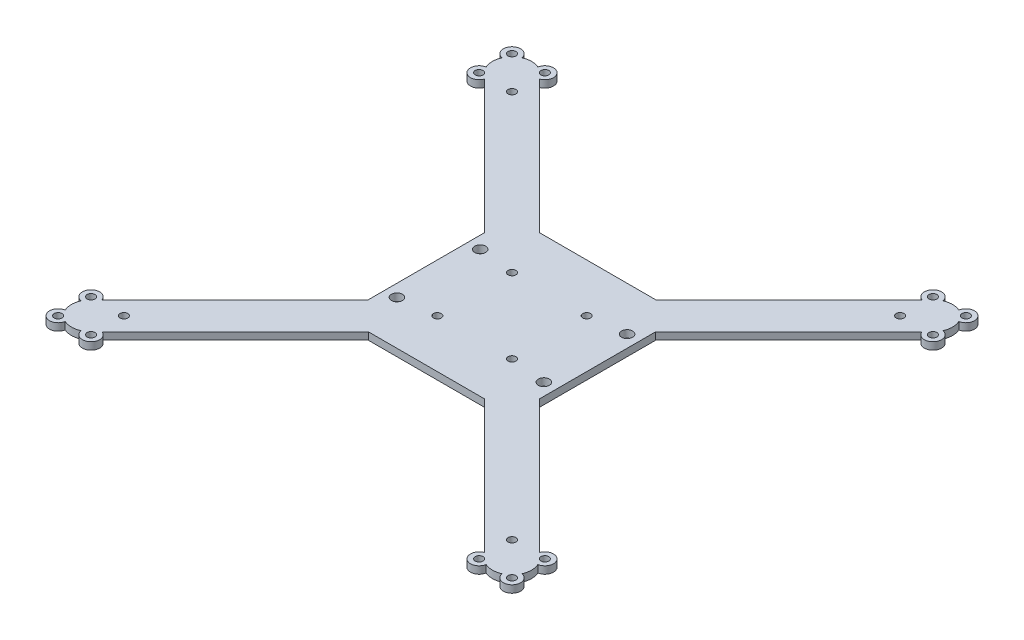
from build123d import *

# Parameters (mm, degrees)
SKETCH1_R           = 1.6
SKETCH1_R_2         = 2.25
BOSS_EXTRUDE1_DEPTH = 3
SKETCH4_R           = 6.495043718
SKETCH4_R_2         = 4.9
BOSS_EXTRUDE3_DEPTH = 5
SKETCH6_W           = 8.48311055
SKETCH6_H           = 1.891574962
CUT_EXTRUDE3_DEPTH  = 34


with BuildPart() as part:
    # Sketch1 → Boss-Extrude1 (new body)
    with BuildSketch(Plane(origin=(0, 0, 0), x_dir=(1, 0, 0), z_dir=(0, 1, 0))):
        with BuildLine():
            Line((-78.067755892, -89.381464391), (-23.686291501, -35))
            Line((-23.686291501, -35), (23.686291501, -35))
            Line((23.686291501, -35), (78.067755892, -89.381464391))
            ThreePointArc((78.067755892, -89.381464391), (76.99339786, -95.359340368), (82.693910545, -93.263296116))
            ThreePointArc((82.693910545, -93.263296116), (85.960678119, -93.960678119), (89.227445693, -93.263296116))
            ThreePointArc((89.227445693, -93.263296116), (95.153066274, -95.153066274), (93.263296116, -89.227445693))
            ThreePointArc((93.263296116, -89.227445693), (93.960678119, -85.960678119), (93.263296116, -82.693910545))
            ThreePointArc((93.263296116, -82.693910545), (95.359340368, -76.99339786), (89.381464391, -78.067755892))
            Line((89.381464391, -78.067755892), (35, -23.686291501))
            Line((35, -23.686291501), (35, 23.686291501))
            Line((35, 23.686291501), (89.381464391, 78.067755892))
            ThreePointArc((89.381464391, 78.067755892), (95.153066274, 76.768289963), (93.853600346, 82.539891847))
            ThreePointArc((93.853600346, 82.539891847), (93.561810399, 82.629787308), (93.263296116, 82.693910545))
            ThreePointArc((93.263296116, 82.693910545), (93.960678119, 85.960678119), (93.263296116, 89.227445693))
            ThreePointArc((93.263296116, 89.227445693), (95.153066274, 95.153066274), (89.227445693, 93.263296116))
            ThreePointArc((89.227445693, 93.263296116), (85.960678119, 93.960678119), (82.693910545, 93.263296116))
            ThreePointArc((82.693910545, 93.263296116), (82.629787308, 93.561810399), (82.539891847, 93.853600346))
            ThreePointArc((82.539891847, 93.853600346), (76.768289963, 95.153066274), (78.067755892, 89.381464391))
            Line((78.067755892, 89.381464391), (23.686291501, 35))
            Line((23.686291501, 35), (-23.686291501, 35))
            Line((-23.686291501, 35), (-78.067755892, 89.381464391))
            ThreePointArc((-78.067755892, 89.381464391), (-76.99339786, 95.359340368), (-82.693910545, 93.263296116))
            ThreePointArc((-82.693910545, 93.263296116), (-85.960678119, 93.960678119), (-89.227445693, 93.263296116))
            ThreePointArc((-89.227445693, 93.263296116), (-95.153066274, 95.153066274), (-93.263296116, 89.227445693))
            ThreePointArc((-93.263296116, 89.227445693), (-93.960678119, 85.960678119), (-93.263296116, 82.693910545))
            ThreePointArc((-93.263296116, 82.693910545), (-95.359340368, 76.99339786), (-89.381464391, 78.067755892))
            Line((-89.381464391, 78.067755892), (-35, 23.686291501))
            Line((-35, 23.686291501), (-35, -23.686291501))
            Line((-35, -23.686291501), (-89.381464391, -78.067755892))
            ThreePointArc((-89.381464391, -78.067755892), (-95.359340368, -76.99339786), (-93.263296116, -82.693910545))
            ThreePointArc((-93.263296116, -82.693910545), (-93.960678119, -85.960678119), (-93.263296116, -89.227445693))
            ThreePointArc((-93.263296116, -89.227445693), (-95.153066274, -95.153066274), (-89.227445693, -93.263296116))
            ThreePointArc((-89.227445693, -93.263296116), (-85.960678119, -93.960678119), (-82.693910545, -93.263296116))
            ThreePointArc((-82.693910545, -93.263296116), (-76.99339786, -95.359340368), (-78.067755892, -89.381464391))
        make_face()
        with Locations((-92.67819254, -92.67819254)):
            Circle(SKETCH1_R, mode=Mode.SUBTRACT)
        with Locations((-79.243163697, -92.67819254)):
            Circle(SKETCH1_R, mode=Mode.SUBTRACT)
        with Locations((-92.67819254, -79.243163697)):
            Circle(SKETCH1_R, mode=Mode.SUBTRACT)
        with Locations((-79.243163697, -79.243163697)):
            Circle(SKETCH1_R, mode=Mode.SUBTRACT)
        with Locations((-30, -17)):
            Circle(SKETCH1_R_2, mode=Mode.SUBTRACT)
        with Locations((-15.25, -15.25)):
            Circle(SKETCH1_R, mode=Mode.SUBTRACT)
        with Locations((79.243163697, -92.67819254)):
            Circle(SKETCH1_R, mode=Mode.SUBTRACT)
        with Locations((92.67819254, -92.67819254)):
            Circle(SKETCH1_R, mode=Mode.SUBTRACT)
        with Locations((79.243163697, -79.243163697)):
            Circle(SKETCH1_R, mode=Mode.SUBTRACT)
        with Locations((92.67819254, -79.243163697)):
            Circle(SKETCH1_R, mode=Mode.SUBTRACT)
        with Locations((15.25, -15.25)):
            Circle(SKETCH1_R, mode=Mode.SUBTRACT)
        with Locations((30, -17)):
            Circle(SKETCH1_R_2, mode=Mode.SUBTRACT)
        with Locations((-30, 17)):
            Circle(SKETCH1_R_2, mode=Mode.SUBTRACT)
        with Locations((-15.25, 15.25)):
            Circle(SKETCH1_R, mode=Mode.SUBTRACT)
        with Locations((-92.67819254, 79.243163697)):
            Circle(SKETCH1_R, mode=Mode.SUBTRACT)
        with Locations((-79.243163697, 79.243163697)):
            Circle(SKETCH1_R, mode=Mode.SUBTRACT)
        with Locations((-92.67819254, 92.67819254)):
            Circle(SKETCH1_R, mode=Mode.SUBTRACT)
        with Locations((-79.243163697, 92.67819254)):
            Circle(SKETCH1_R, mode=Mode.SUBTRACT)
        with Locations((15.25, 15.25)):
            Circle(SKETCH1_R, mode=Mode.SUBTRACT)
        with Locations((30, 17)):
            Circle(SKETCH1_R_2, mode=Mode.SUBTRACT)
        with Locations((79.243163697, 79.243163697)):
            Circle(SKETCH1_R, mode=Mode.SUBTRACT)
        with Locations((92.67819254, 79.243163697)):
            Circle(SKETCH1_R, mode=Mode.SUBTRACT)
        with Locations((79.243163697, 92.67819254)):
            Circle(SKETCH1_R, mode=Mode.SUBTRACT)
        with Locations((92.67819254, 92.67819254)):
            Circle(SKETCH1_R, mode=Mode.SUBTRACT)
    extrude(amount=BOSS_EXTRUDE1_DEPTH)

    # Sketch4 → Boss-Extrude3 (add)
    with BuildSketch(Plane.XZ):
        Circle(SKETCH4_R)
        Circle(SKETCH4_R_2, mode=Mode.SUBTRACT)
    extrude(amount=BOSS_EXTRUDE3_DEPTH)

    # Sketch6 → Cut-Extrude3 (cut)
    with BuildSketch(Plane.XY.offset(35)):
        with Locations((0, -0.945787481)):
            Rectangle(SKETCH6_W, SKETCH6_H)
    extrude(amount=-CUT_EXTRUDE3_DEPTH, mode=Mode.SUBTRACT)


solid = part.part
